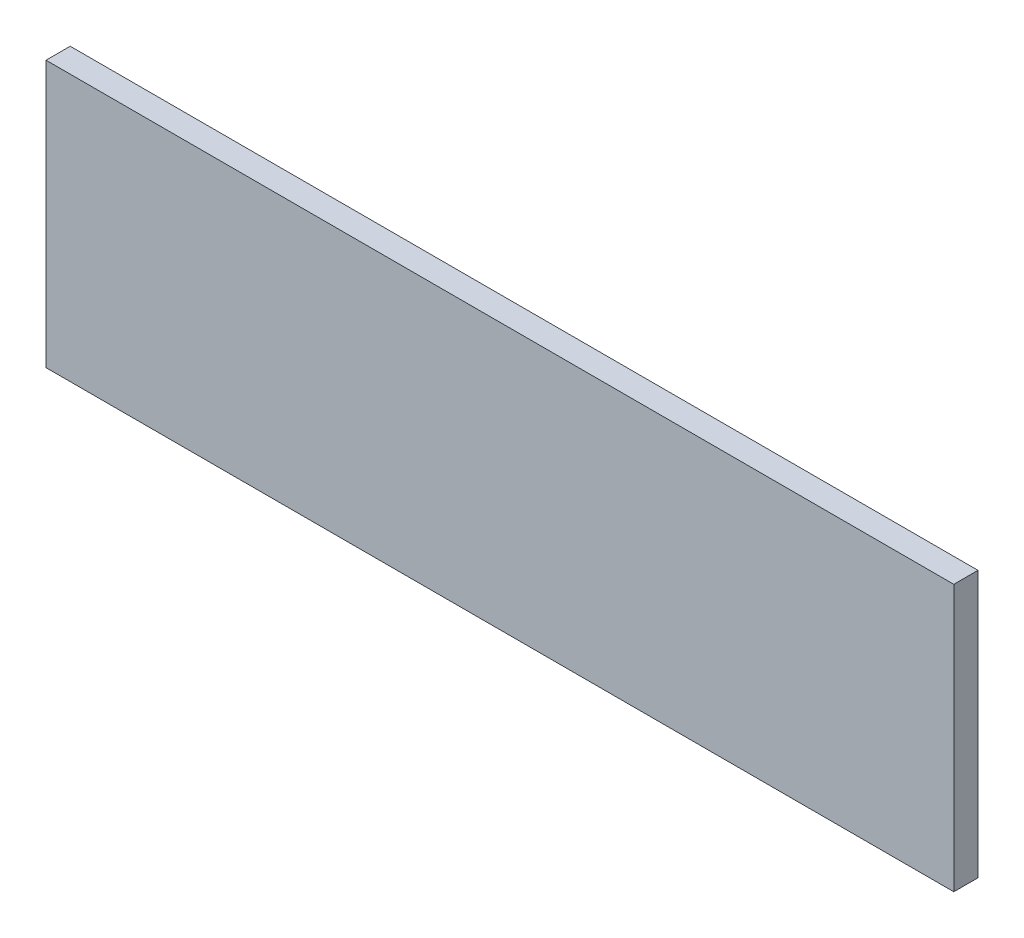
from build123d import *

# Parameters (mm, degrees)
ESQUISSE1_W        = 150
ESQUISSE1_H        = 44
BOSS_EXTRU_1_DEPTH = 4


with BuildPart() as part:
    # Esquisse1 → Boss.-Extru.1 (new body)
    with BuildSketch(Plane.XY):
        with Locations((38.833729247, 0.332802548)):
            Rectangle(ESQUISSE1_W, ESQUISSE1_H)
    extrude(amount=BOSS_EXTRU_1_DEPTH)


solid = part.part
